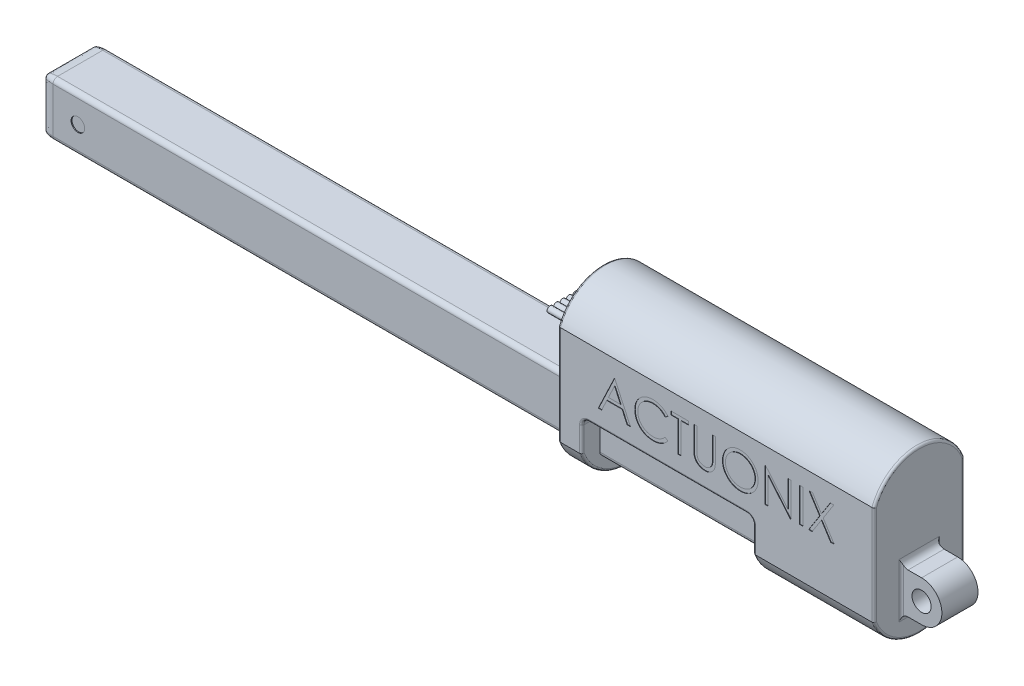
from build123d import *

# Parameters (mm, degrees)
SKETCH1_R               = 2.125
BOSS_EXTRUDE1_DEPTH     = 10
SKETCH2_W               = 9
SKETCH2_H               = 6
CUT_EXTRUDE1_DEPTH      = 58.723478759
SKETCH3_W               = 38
SKETCH3_H               = 4.5
CUT_EXTRUDE2_DEPTH      = 52.575187833
SKETCH4_W               = 38
SKETCH4_H               = 4
CUT_EXTRUDE3_DEPTH      = 9.5
CUT_EXTRUDE4_DEPTH      = 73.965745388
CUT_EXTRUDE4_DEPTH_BACK = 73.965745388
CUT_EXTRUDE5_DEPTH      = 73.965745388
BOSS_EXTRUDE2_DEPTH     = 4.31
SKETCH8_R               = 0.675
BOSS_EXTRUDE3_DEPTH     = 7.5
BOSS_EXTRUDE3_2_DEPTH   = 7.5
BOSS_EXTRUDE3_3_DEPTH   = 7.5
BOSS_EXTRUDE3_4_DEPTH   = 7.5
BOSS_EXTRUDE3_5_DEPTH   = 7.5
BOSS_EXTRUDE4_DEPTH     = 117.9
SKETCH10_R              = 4.5
CUT_EXTRUDE6_DEPTH      = 50
SKETCH12_W              = 0.673076923
SKETCH12_H              = 7.5
CUT_EXTRUDE7_DEPTH      = 0.1
SKETCH13_W              = 0.673076923
SKETCH13_H              = 7.5
CUT_EXTRUDE8_DEPTH      = 0.1
FILLET1_SIZE            = 2
FILLET1_SIZE_2          = 0.5
SKETCH14_R              = 1.5
CUT_EXTRUDE9_DEPTH      = 0.2
SKETCH15_R              = 1.5
CUT_EXTRUDE10_DEPTH     = 0.2
FILLET2_R               = 1.5
FILLET3_R               = 1.5
FILLET4_R               = 0.5
FILLET5_R               = 1
FILLET6_R               = 0.5


with BuildPart() as part:
    # Sketch1 → Boss-Extrude1 (new, symmetric)
    with BuildSketch(Plane.XY):
        with BuildLine():
            Line((39.5, -12), (35, -12))
            Line((35, -12), (35, -18))
            Line((35, -18), (-35, -18))
            Line((-35, -18), (-35, 18))
            Line((-35, 18), (35, 18))
            Line((35, 18), (35, -3))
            Line((35, -3), (39.5, -3))
            ThreePointArc((39.5, -3), (44, -7.5), (39.5, -12))
        make_face()
        with Locations((39.5, -7.5)):
            Circle(SKETCH1_R, mode=Mode.SUBTRACT)
    extrude(amount=BOSS_EXTRUDE1_DEPTH, both=True)

    # Sketch2 → Cut-Extrude1 (cut, through all)
    with BuildSketch(Plane(origin=(0, 18, 0), x_dir=(1, 0, 0), z_dir=(0, 1, 0))):
        with Locations((39.5, -7)):
            Rectangle(SKETCH2_W, SKETCH2_H)
        with Locations((39.5, 7)):
            Rectangle(SKETCH2_W, SKETCH2_H)
    extrude(amount=-CUT_EXTRUDE1_DEPTH, mode=Mode.SUBTRACT)

    # Sketch3 → Cut-Extrude2 (cut, through all)
    with BuildSketch(Plane.XY.offset(10)):
        with Locations((-10.75, -15.75)):
            Rectangle(SKETCH3_W, SKETCH3_H)
    extrude(amount=-CUT_EXTRUDE2_DEPTH, mode=Mode.SUBTRACT)

    # Sketch4 → Cut-Extrude3 (cut)
    with BuildSketch(Plane.XZ.offset(13.5)):
        with Locations((-10.75, -8)):
            Rectangle(SKETCH4_W, SKETCH4_H)
        with Locations((-10.75, 8)):
            Rectangle(SKETCH4_W, SKETCH4_H)
    extrude(amount=-CUT_EXTRUDE3_DEPTH, mode=Mode.SUBTRACT)

    # Sketch6 → Cut-Extrude4 (cut, two sides: drawn at the far end of the back side and taken through both)
    with BuildSketch(Plane(origin=(35, 0, 0), x_dir=(0, 0, -1), z_dir=(1, 0, 0)).offset(-CUT_EXTRUDE4_DEPTH_BACK)):
        with BuildLine():
            Line((-10, 18), (-10, 11))
            ThreePointArc((-10, 11), (-6.103277819, 16.076111146), (-2.8e-08, 18))
            Line((-2.8e-08, 18), (-10, 18))
        make_face()
        with BuildLine():
            Line((10, 18), (-2.8e-08, 18))
            ThreePointArc((-2.8e-08, 18), (6.103277797, 16.076111162), (10, 11))
            Line((10, 11), (10, 18))
        make_face()
    extrude(amount=CUT_EXTRUDE4_DEPTH + CUT_EXTRUDE4_DEPTH_BACK, mode=Mode.SUBTRACT)

    # Sketch7 → Cut-Extrude5 (cut, through all)
    with BuildSketch(Plane(origin=(35, 0, 0), x_dir=(0, 0, -1), z_dir=(1, 0, 0))):
        with BuildLine():
            ThreePointArc((-4.6e-08, -18), (-6.103277827, -16.076111141), (-10, -11))
            Line((-10, -11), (-10, -18))
            Line((-10, -18), (-4.6e-08, -18))
        make_face()
        with BuildLine():
            ThreePointArc((10, -11), (6.103277789, -16.076111167), (-4.6e-08, -18))
            Line((-4.6e-08, -18), (10, -18))
            Line((10, -18), (10, -11))
        make_face()
    extrude(amount=-CUT_EXTRUDE5_DEPTH, mode=Mode.SUBTRACT)

    # Sketch12 → Cut-Extrude7 (cut)
    # profile 1 of 8: a face of its own
    with BuildSketch(Plane.XY.offset(10)):
        Polygon((-22.451923077, 7.25), (-18.990384615, -0.25), (-19.722055288, -0.25), (-20.830829327, 2.153846154), (-24.230769231, 2.153846154), (-25.37109375, -0.25), (-26.105769231, -0.25), (-22.548076923, 7.25), align=None)
        Polygon((-22.507512019, 5.788161058), (-23.865685096, 2.923076923), (-21.185396635, 2.923076923), align=None, mode=Mode.SUBTRACT)
    # profile 2 of 8: a face of its own
    with BuildSketch(Plane.XY.offset(10)):
        with BuildLine():
            Line((-10.721153846, 5.873798077), (-11.310096154, 5.423076923))
            add(Edge.make_bspline(
                [(-11.310096154, 5.423076923), (-11.352108772, 5.473146858), (-11.435567586, 5.572611678), (-11.569837306, 5.71228213), (-11.709769398, 5.843136262), (-11.855310372, 5.965797433), (-12.009079914, 6.075976216), (-12.167353054, 6.179414294), (-12.332777436, 6.272130875), (-12.561531153, 6.38455156), (-12.860776543, 6.501864749), (-13.237479769, 6.600228816), (-13.630717837, 6.662845621), (-13.898998408, 6.669627424), (-14.035456731, 6.673076923)],
                knots=[0, 0, 0, 0, 0.757959112, 1.505699292, 2.245454638, 2.979532153, 3.711538275, 4.438200793, 5.171680507, 5.909471876, 7.393775596, 8.890124382, 10.418191784, 12, 12, 12, 12], degree=3))
            add(Edge.make_bspline(
                [(-14.035456731, 6.673076923), (-14.110635229, 6.672211289), (-14.260294499, 6.670488055), (-14.482398371, 6.647754215), (-14.700354909, 6.615801622), (-14.914022337, 6.568390216), (-15.123128676, 6.508448889), (-15.329040967, 6.436823002), (-15.528777966, 6.348205488), (-15.725102762, 6.250259217), (-15.913201072, 6.139628978), (-16.091176174, 6.01895751), (-16.258378962, 5.88959516), (-16.414941703, 5.751057075), (-16.561024449, 5.60396716), (-16.695568687, 5.446757856), (-16.818108851, 5.27993177), (-16.931073905, 5.105688754), (-17.032244048, 4.924536343), (-17.116950932, 4.73580405), (-17.191961909, 4.542723829), (-17.251317428, 4.343114198), (-17.298298536, 4.1383797), (-17.330714957, 3.927970869), (-17.353190253, 3.71232727), (-17.354904917, 3.566164457), (-17.355769231, 3.492487981)],
                knots=[0, 0, 0, 0, 1.054917814, 2.100044995, 3.131103042, 4.146048494, 5.169673617, 6.183595914, 7.203665975, 8.234915748, 9.262203917, 10.264457458, 11.251630812, 12.227803204, 13.197192746, 14.159520551, 15.12972552, 16.100847026, 17.073214652, 18.039054194, 19.002613845, 19.979014051, 20.95965708, 21.949030935, 22.966165397, 24, 24, 24, 24], degree=3))
            add(Edge.make_bspline(
                [(-17.355769231, 3.492487981), (-17.353065333, 3.381635152), (-17.347756588, 3.163990328), (-17.300510158, 2.845196162), (-17.228713534, 2.539794718), (-17.121108726, 2.249695056), (-16.988425046, 1.971320003), (-16.820766593, 1.709379603), (-16.626588299, 1.459915536), (-16.403143114, 1.228823505), (-16.157987794, 1.017722666), (-15.894956555, 0.831828562), (-15.61470451, 0.6768681), (-15.320326016, 0.547919643), (-15.009555772, 0.448798084), (-14.682952624, 0.379017819), (-14.34122692, 0.333498861), (-14.107721063, 0.329140958), (-13.988882212, 0.326923077)],
                knots=[0, 0, 0, 0, 1.029171465, 2.020641659, 2.987623507, 3.938342917, 4.889210282, 5.84687017, 6.821220943, 7.821438502, 8.827599549, 9.822697543, 10.807740252, 11.797342354, 12.80366471, 13.83203677, 14.896651826, 16, 16, 16, 16], degree=3))
            add(Edge.make_bspline(
                [(-13.988882212, 0.326923077), (-13.857947878, 0.330541891), (-13.600237787, 0.337664582), (-13.222306302, 0.39800583), (-12.860515376, 0.495844225), (-12.514845548, 0.632768345), (-12.186271306, 0.81076539), (-11.874278462, 1.026546556), (-11.578603668, 1.282164412), (-11.400808064, 1.477342544), (-11.310096154, 1.576923077)],
                knots=[0, 0, 0, 0, 1.028121516, 2.023589091, 2.998037872, 3.967518031, 4.937445131, 5.927275754, 6.942489185, 8, 8, 8, 8], degree=3))
            Line((-11.310096154, 1.576923077), (-10.721153846, 1.130709135))
            add(Edge.make_bspline(
                [(-10.721153846, 1.130709135), (-10.768549796, 1.069555309), (-10.863114671, 0.947540581), (-11.016238994, 0.775529775), (-11.177547488, 0.613735413), (-11.348238295, 0.463461939), (-11.526347849, 0.32170237), (-11.715074232, 0.19248416), (-11.911936445, 0.074003694), (-12.116267471, -0.034482573), (-12.327850213, -0.130733817), (-12.546431145, -0.213134748), (-12.771068092, -0.284116654), (-13.001771324, -0.342513661), (-13.239019375, -0.388094555), (-13.481956105, -0.418565287), (-13.731105838, -0.439440818), (-13.899194597, -0.441343495), (-13.984375, -0.442307692)],
                knots=[0, 0, 0, 0, 0.986787822, 1.968848986, 2.935600012, 3.899624008, 4.868462664, 5.837806735, 6.815139263, 7.798259679, 8.787526145, 9.778297419, 10.776456485, 11.791383307, 12.812564526, 13.85620153, 14.913611965, 16, 16, 16, 16], degree=3))
            add(Edge.make_bspline(
                [(-13.984375, -0.442307692), (-14.065040001, -0.44174628), (-14.224545051, -0.440636156), (-14.460042376, -0.42265294), (-14.689305763, -0.398117789), (-14.911679962, -0.361174651), (-15.12837848, -0.317579637), (-15.337436875, -0.25914123), (-15.540912326, -0.19367873), (-15.737987341, -0.116739473), (-15.928829555, -0.029919082), (-16.112823437, 0.068205687), (-16.289884363, 0.176809683), (-16.461753122, 0.293498991), (-16.625890802, 0.422021781), (-16.783719785, 0.560593141), (-16.936125091, 0.708746021), (-17.030416559, 0.815577849), (-17.077824519, 0.869290865)],
                knots=[0, 0, 0, 0, 1.114604814, 2.203992996, 3.262667896, 4.300477797, 5.318619304, 6.316056647, 7.298880507, 8.271930387, 9.238335007, 10.195173496, 11.151986948, 12.108099108, 13.064862484, 14.031167946, 15.010108607, 16, 16, 16, 16], degree=3))
            add(Edge.make_bspline(
                [(-17.077824519, 0.869290865), (-17.153758041, 0.962593413), (-17.304708349, 1.148072078), (-17.497834813, 1.448684895), (-17.663151003, 1.762545343), (-17.79681369, 2.091302333), (-17.901305261, 2.434218163), (-17.973693537, 2.791465694), (-18.020732689, 3.162711284), (-18.026111879, 3.415218688), (-18.028846154, 3.543569712)],
                knots=[0, 0, 0, 0, 0.994628077, 1.977248131, 2.950237994, 3.925870899, 4.908910175, 5.911660606, 6.938484602, 8, 8, 8, 8], degree=3))
            add(Edge.make_bspline(
                [(-18.028846154, 3.543569712), (-18.025513596, 3.678474255), (-18.018956997, 3.943890522), (-17.963251721, 4.333406136), (-17.873640015, 4.706587705), (-17.746360968, 5.062738586), (-17.584992358, 5.403732044), (-17.385649614, 5.726963197), (-17.150648595, 6.034499196), (-16.881832379, 6.321673663), (-16.587045232, 6.58425799), (-16.271362059, 6.815271284), (-15.935400744, 7.007523104), (-15.58286249, 7.168229167), (-15.211107458, 7.291753016), (-14.82092881, 7.37822413), (-14.413059707, 7.432046522), (-14.134783081, 7.438850539), (-13.993389423, 7.442307692)],
                knots=[0, 0, 0, 0, 1.032925535, 2.032216505, 3.007276963, 3.968222605, 4.92396291, 5.891752235, 6.871517503, 7.883894988, 8.900124299, 9.891468569, 10.874487609, 11.85992873, 12.854644235, 13.869047385, 14.917252991, 16, 16, 16, 16], degree=3))
            add(Edge.make_bspline(
                [(-13.993389423, 7.442307692), (-13.907215555, 7.441274539), (-13.73664306, 7.439229516), (-13.484315948, 7.419287783), (-13.238653819, 7.386044341), (-12.999487429, 7.34079562), (-12.765653251, 7.284637074), (-12.538938449, 7.211479292), (-12.318012692, 7.127829582), (-12.104269317, 7.031490012), (-11.898733853, 6.923346995), (-11.701470313, 6.80459923), (-11.514045616, 6.675393933), (-11.33514094, 6.536829985), (-11.16774906, 6.38597593), (-11.00711732, 6.226981081), (-10.858700724, 6.055265744), (-10.767086735, 5.934398028), (-10.721153846, 5.873798077)],
                knots=[0, 0, 0, 0, 1.096760587, 2.17092713, 3.219439832, 4.250915756, 5.268269357, 6.278326846, 7.281116186, 8.274029601, 9.260640565, 10.235837813, 11.203064059, 12.156899882, 13.114053108, 14.069676657, 15.032185724, 16, 16, 16, 16], degree=3))
        make_face()
    # profile 3 of 8: a face of its own
    with BuildSketch(Plane.XY.offset(10)):
        Polygon((-10.048076923, 6.480769231), (-10.048076923, 7.25), (-6.105769231, 7.25), (-6.105769231, 6.480769231), (-7.740384615, 6.480769231), (-7.740384615, -0.25), (-8.413461538, -0.25), (-8.413461538, 6.480769231), align=None)
    # profile 4 of 8: a face of its own
    with BuildSketch(Plane.XY.offset(10)):
        with BuildLine():
            Line((-4.951923077, 7.25), (-4.278846154, 7.25))
            Line((-4.278846154, 7.25), (-4.278846154, 2.756310096))
            add(Edge.make_bspline(
                [(-4.278846154, 2.756310096), (-4.27894632, 2.69270852), (-4.279136401, 2.572013568), (-4.277866729, 2.400224352), (-4.274310939, 2.247497654), (-4.272069169, 2.113244766), (-4.267082025, 1.998081736), (-4.263014782, 1.901384642), (-4.257785018, 1.823611351), (-4.251499766, 1.778223652), (-4.248798077, 1.758713942)],
                knots=[0, 0, 0, 0, 1.528628734, 2.90083645, 4.128790002, 5.200304208, 6.127813768, 6.898992206, 7.526736466, 8, 8, 8, 8], degree=3))
            add(Edge.make_bspline(
                [(-4.248798077, 1.758713942), (-4.237703522, 1.688328021), (-4.216139552, 1.551522173), (-4.161183028, 1.356718712), (-4.08443124, 1.181151301), (-3.993481863, 1.019341391), (-3.873626267, 0.875792763), (-3.730047263, 0.743553507), (-3.556094902, 0.62789964), (-3.362679318, 0.5221479), (-3.154210952, 0.437151295), (-2.94118681, 0.3728798), (-2.726808997, 0.333710729), (-2.583288644, 0.329175288), (-2.512019231, 0.326923077)],
                knots=[0, 0, 0, 0, 1.035780045, 2.013197591, 2.933192213, 3.817615948, 4.702609284, 5.640816605, 6.646850145, 7.73207398, 8.84249596, 9.914020372, 10.964143139, 12, 12, 12, 12], degree=3))
            add(Edge.make_bspline(
                [(-2.512019231, 0.326923077), (-2.450832644, 0.329224185), (-2.328812869, 0.33381311), (-2.147513374, 0.362230462), (-1.970941713, 0.41344596), (-1.79822597, 0.479531156), (-1.636331004, 0.566847423), (-1.485166485, 0.667713507), (-1.350243769, 0.786022528), (-1.227119488, 0.916951837), (-1.119901768, 1.06467998), (-1.026963608, 1.225990276), (-0.950836615, 1.403310305), (-0.913243348, 1.527926924), (-0.893930288, 1.591947115)],
                knots=[0, 0, 0, 0, 0.994687771, 1.983630487, 2.973142513, 3.978332533, 4.983357753, 5.956394766, 6.925816176, 7.893390482, 8.871859704, 9.88551698, 10.913711441, 12, 12, 12, 12], degree=3))
            add(Edge.make_bspline(
                [(-0.893930288, 1.591947115), (-0.887501449, 1.618408346), (-0.873175402, 1.677374632), (-0.859788877, 1.777063112), (-0.845846323, 1.894683177), (-0.836172244, 2.031079919), (-0.826741058, 2.185796289), (-0.821098759, 2.359638269), (-0.818490831, 2.551974614), (-0.817713659, 2.686197103), (-0.817307692, 2.756310096)],
                knots=[0, 0, 0, 0, 0.558680831, 1.244966039, 2.062412453, 2.990489873, 4.051219941, 5.244515665, 6.560634259, 8, 8, 8, 8], degree=3))
            Line((-0.817307692, 2.756310096), (-0.817307692, 7.25))
            Line((-0.817307692, 7.25), (-0.144230769, 7.25))
            Line((-0.144230769, 7.25), (-0.144230769, 2.720252404))
            add(Edge.make_bspline(
                [(-0.144230769, 2.720252404), (-0.144775313, 2.63861302), (-0.145838023, 2.4792888), (-0.155053544, 2.245821602), (-0.169747115, 2.024350928), (-0.190507304, 1.814847007), (-0.218015168, 1.618059523), (-0.248604926, 1.432263591), (-0.287561068, 1.258792892), (-0.333061214, 1.096294854), (-0.385075959, 0.941611611), (-0.452449849, 0.794807437), (-0.528359491, 0.651419438), (-0.61839089, 0.513616347), (-0.719558139, 0.380788019), (-0.834097455, 0.253740001), (-0.958220657, 0.130442045), (-1.093991142, 0.014056903), (-1.239170839, -0.092675976), (-1.393327891, -0.186528342), (-1.555278112, -0.265864666), (-1.724600525, -0.331170218), (-1.901367388, -0.38027293), (-2.085583159, -0.41686255), (-2.277667145, -0.437653187), (-2.408305694, -0.440743038), (-2.474459135, -0.442307692)],
                knots=[0, 0, 0, 0, 1.316592851, 2.569410997, 3.76748051, 4.895814652, 5.963796859, 6.97159953, 7.931736103, 8.829262218, 9.692595152, 10.560224239, 11.431080259, 12.30701507, 13.211635791, 14.121146779, 15.063487852, 16.031507147, 17.00238618, 17.966455255, 18.938106653, 19.907068911, 20.888905087, 21.893141452, 22.933117798, 24, 24, 24, 24], degree=3))
            add(Edge.make_bspline(
                [(-2.474459135, -0.442307692), (-2.546607212, -0.440626052), (-2.688161481, -0.437326681), (-2.896743053, -0.418420788), (-3.096702045, -0.382809943), (-3.290150353, -0.337467206), (-3.474454276, -0.274930627), (-3.652083085, -0.201863216), (-3.819994545, -0.11212623), (-3.980912677, -0.012283245), (-4.130537155, 0.100055266), (-4.267888733, 0.222498495), (-4.39319417, 0.353085018), (-4.504341376, 0.493228659), (-4.603171843, 0.64183946), (-4.688308015, 0.799337831), (-4.761407824, 0.965662794), (-4.799136182, 1.081276795), (-4.818209135, 1.139723558)],
                knots=[0, 0, 0, 0, 1.13879206, 2.234305948, 3.301075583, 4.341971843, 5.366689343, 6.369221514, 7.369726634, 8.367512178, 9.355451585, 10.318319045, 11.268648973, 12.207971039, 13.137398894, 14.081662264, 15.030215811, 16, 16, 16, 16], degree=3))
            add(Edge.make_bspline(
                [(-4.818209135, 1.139723558), (-4.829303045, 1.179650503), (-4.853365984, 1.266252936), (-4.879134479, 1.409581126), (-4.900796796, 1.574613093), (-4.92116585, 1.761360132), (-4.933185045, 1.969966989), (-4.943722414, 2.200343237), (-4.951997311, 2.452767441), (-4.951948513, 2.628598546), (-4.951923077, 2.720252404)],
                knots=[0, 0, 0, 0, 0.625038921, 1.35572334, 2.194682327, 3.136881307, 4.189498639, 5.346923369, 6.617055217, 8, 8, 8, 8], degree=3))
            Line((-4.951923077, 2.720252404), (-4.951923077, 7.25))
        make_face()
    # profile 5 of 8: a face of its own
    with BuildSketch(Plane.XY.offset(10)):
        with BuildLine():
            add(Edge.make_bspline(
                [(5.288461538, 7.442307692), (5.427336051, 7.438790237), (5.700097052, 7.431881663), (6.100971833, 7.37899787), (6.483675608, 7.287507748), (6.851325906, 7.1656585), (7.199525141, 7.003113389), (7.530894196, 6.806645214), (7.84464464, 6.574195659), (8.136547601, 6.307561602), (8.403669637, 6.0174542), (8.639010822, 5.707858679), (8.836244309, 5.38064696), (8.998213852, 5.036802323), (9.125282302, 4.677102391), (9.212965967, 4.299629528), (9.268976289, 3.906829478), (9.275524383, 3.638914768), (9.278846154, 3.503004808)],
                knots=[0, 0, 0, 0, 1.065120563, 2.091984664, 3.0946048, 4.079830382, 5.057816894, 6.036188127, 7.030412546, 8.04752943, 9.064399622, 10.05169764, 11.02544977, 11.989514704, 12.962713494, 13.945757189, 14.957906945, 16, 16, 16, 16], degree=3))
            add(Edge.make_bspline(
                [(9.278846154, 3.503004808), (9.27552487, 3.368095994), (9.268978234, 3.102175093), (9.212902283, 2.711867713), (9.124957283, 2.336673363), (8.999393855, 1.977218393), (8.838196401, 1.633123613), (8.639649606, 1.305294427), (8.405775583, 0.993623359), (8.139618045, 0.70152479), (7.849472955, 0.433673067), (7.53826524, 0.200275477), (7.21299384, -0.000561933), (6.869473037, -0.160812663), (6.512258673, -0.28889535), (6.138153695, -0.376222414), (5.748911079, -0.432551793), (5.483473214, -0.439020041), (5.348557692, -0.442307692)],
                knots=[0, 0, 0, 0, 1.043624062, 2.057103931, 3.04512605, 4.022047818, 4.998200453, 5.980619268, 6.982898556, 8.009068085, 9.034988726, 10.034168286, 11.015286542, 11.987931943, 12.962482838, 13.94673481, 14.956375938, 16, 16, 16, 16], degree=3))
            add(Edge.make_bspline(
                [(5.348557692, -0.442307692), (5.212648437, -0.438987578), (4.944735117, -0.432442748), (4.55144147, -0.376339737), (4.173703448, -0.288608372), (3.812601267, -0.163231009), (3.46793356, -0.001194086), (3.13902624, 0.196386726), (2.827199496, 0.4308306), (2.535038611, 0.696901832), (2.2677189, 0.986555157), (2.034663095, 1.296914275), (1.837037853, 1.621890254), (1.675544997, 1.962384948), (1.547692584, 2.316752326), (1.460467974, 2.687356206), (1.404033791, 3.072083718), (1.397530549, 3.334032786), (1.394230769, 3.466947115)],
                knots=[0, 0, 0, 0, 1.053102029, 2.075944431, 3.073151272, 4.055350789, 5.033113405, 6.020478099, 7.024410459, 8.052272461, 9.079885166, 10.07527673, 11.055994387, 12.023226415, 12.992069828, 13.970394897, 14.97016774, 16, 16, 16, 16], degree=3))
            add(Edge.make_bspline(
                [(1.394230769, 3.466947115), (1.395376417, 3.556159978), (1.397653259, 3.733460242), (1.425064028, 3.996745814), (1.464839102, 4.255797224), (1.521843201, 4.509877827), (1.596396773, 4.758365651), (1.684365403, 5.002974428), (1.791807929, 5.241225265), (1.91326646, 5.474246819), (2.048827478, 5.698406617), (2.198561226, 5.910291438), (2.357208444, 6.111679288), (2.531130002, 6.297351439), (2.714593813, 6.472709274), (2.910576052, 6.635057954), (3.117880862, 6.78586142), (3.337400247, 6.921762151), (3.563725122, 7.044674582), (3.797032503, 7.150149977), (4.034153727, 7.240677252), (4.276199401, 7.314050449), (4.52252677, 7.37197624), (4.773673451, 7.411420569), (5.029439365, 7.438901251), (5.201749334, 7.441167326), (5.288461538, 7.442307692)],
                knots=[0, 0, 0, 0, 1.037015668, 2.060948919, 3.074880161, 4.083647147, 5.086022904, 6.090072063, 7.104153813, 8.122640571, 9.144368836, 10.147691507, 11.138137339, 12.123020368, 13.103399296, 14.087645067, 15.080126199, 16.082011238, 17.087798457, 18.072939717, 19.057185487, 20.037253025, 21.01195951, 21.997135196, 22.992090687, 24, 24, 24, 24], degree=3))
        make_face()
        with BuildLine():
            add(Edge.make_bspline(
                [(5.321514423, 6.673076923), (5.250340208, 6.672209301), (5.108672209, 6.670482352), (4.898062489, 6.64773439), (4.69022263, 6.615313199), (4.485109712, 6.569067083), (4.283581949, 6.506058399), (4.08376086, 6.433542167), (3.887468602, 6.345211258), (3.695353192, 6.245412606), (3.509106603, 6.134950633), (3.3333651, 6.012868275), (3.16767372, 5.882028516), (3.012438148, 5.742126007), (2.868114208, 5.592448289), (2.731861276, 5.435264498), (2.609140744, 5.266081874), (2.496671651, 5.089488145), (2.396026279, 4.905713328), (2.30652909, 4.716692195), (2.2333205, 4.520882866), (2.173615408, 4.320409671), (2.124115813, 4.115590115), (2.092757404, 3.904870438), (2.069759491, 3.689309484), (2.068131251, 3.543634083), (2.067307692, 3.469951923)],
                knots=[0, 0, 0, 0, 1.008559885, 2.007477868, 2.99961109, 3.989939068, 4.984837346, 5.991145699, 7.001802488, 8.033829008, 9.059044045, 10.069351652, 11.065060232, 12.050310815, 13.029377138, 14.011219647, 14.996725999, 15.989392538, 16.977580475, 17.965360261, 18.951710183, 19.937753436, 20.929683414, 21.935841486, 22.955955122, 24, 24, 24, 24], degree=3))
            add(Edge.make_bspline(
                [(2.067307692, 3.469951923), (2.070039539, 3.361604307), (2.075413928, 3.148451028), (2.122465864, 2.83609072), (2.194941523, 2.535901535), (2.301778737, 2.249526015), (2.435387197, 1.974502551), (2.600444819, 1.713270899), (2.796000002, 1.465760454), (3.018136131, 1.233699163), (3.260970502, 1.021886725), (3.518826352, 0.835965135), (3.788941225, 0.678657457), (4.072019517, 0.550503731), (4.366549957, 0.448954292), (4.674430424, 0.379357226), (4.99360998, 0.333552678), (5.21117567, 0.329153916), (5.321514423, 0.326923077)],
                knots=[0, 0, 0, 0, 1.032063989, 2.030389145, 3.003944642, 3.970395727, 4.937377036, 5.913328081, 6.909231446, 7.93887556, 8.970685674, 9.976071282, 10.964166581, 11.944589148, 12.933237628, 13.927779006, 14.949070134, 16, 16, 16, 16], degree=3))
            add(Edge.make_bspline(
                [(5.321514423, 0.326923077), (5.395677641, 0.327942015), (5.542765576, 0.329962875), (5.761541695, 0.350317182), (5.976376435, 0.382956902), (6.186968463, 0.429951164), (6.393078773, 0.488766607), (6.595567637, 0.55864031), (6.792278259, 0.645814318), (6.985692197, 0.742131357), (7.170827001, 0.851931694), (7.347560284, 0.969870586), (7.511437384, 1.100517631), (7.666556823, 1.238341515), (7.811473299, 1.386121189), (7.945206837, 1.543664521), (8.06730712, 1.71196593), (8.179733506, 1.888291799), (8.280026211, 2.072569483), (8.367409995, 2.262275936), (8.441544529, 2.456944028), (8.501391325, 2.656854538), (8.548288743, 2.861627785), (8.580602857, 3.071537953), (8.603206654, 3.286165115), (8.604910391, 3.431330521), (8.605769231, 3.504507212)],
                knots=[0, 0, 0, 0, 1.047197238, 2.076906641, 3.100256066, 4.114471768, 5.12198147, 6.126382909, 7.136867548, 8.15857795, 9.17633901, 10.174870724, 11.156907918, 12.133735059, 13.104061851, 14.077631395, 15.04955518, 16.038496417, 17.029181396, 18.010275684, 18.986308667, 19.968651475, 20.955262928, 21.950658345, 22.966943676, 24, 24, 24, 24], degree=3))
            add(Edge.make_bspline(
                [(8.605769231, 3.504507212), (8.604909703, 3.577183292), (8.603204671, 3.721349685), (8.580613654, 3.93448001), (8.548254603, 4.142879749), (8.501620229, 4.345730756), (8.441512757, 4.543084738), (8.367397049, 4.73475634), (8.279999978, 4.921459615), (8.17969664, 5.102733109), (8.066948447, 5.276678976), (7.943746497, 5.44296986), (7.807963608, 5.598482877), (7.663479269, 5.747057222), (7.506684515, 5.885524128), (7.338289599, 6.013929529), (7.160338861, 6.13537226), (6.971923357, 6.244927035), (6.777472027, 6.346100391), (6.577942117, 6.432781112), (6.375594047, 6.506435654), (6.170942377, 6.569257722), (5.962264567, 6.615132072), (5.750970648, 6.647763607), (5.537352951, 6.670474434), (5.393688909, 6.672206674), (5.321514423, 6.673076923)],
                knots=[0, 0, 0, 0, 1.02996197, 2.043119294, 3.035359645, 4.018872909, 4.991431989, 5.957985074, 6.929999688, 7.912076566, 8.892894881, 9.867085534, 10.843653904, 11.817741046, 12.803660682, 13.806313499, 14.818574707, 15.856120519, 16.894564902, 17.924820532, 18.937903209, 19.946497019, 20.957711757, 21.963978472, 22.977135795, 24, 24, 24, 24], degree=3))
        make_face(mode=Mode.SUBTRACT)
    # profile 6 of 8: a face of its own
    with BuildSketch(Plane.XY.offset(10)):
        Polygon((10.817307692, -0.25), (10.817307692, 7.25), (10.958533654, 7.25), (15.913461538, 1.347055288), (15.913461538, 7.25), (16.586538462, 7.25), (16.586538462, -0.25), (16.433293269, -0.25), (11.490384615, 5.639423077), (11.490384615, -0.25), align=None)
    # profile 7 of 8: a face of its own
    with BuildSketch(Plane.XY.offset(10)):
        with Locations((18.846153847, 3.5)):
            Rectangle(SKETCH12_W, SKETCH12_H)
    # profile 8 of 8: a face of its own
    with BuildSketch(Plane.XY.offset(10)):
        Polygon((20.576923077, 7.25), (21.353665865, 7.25), (23.317307692, 4.182091346), (25.280949519, 7.25), (26.057692308, 7.25), (23.706430288, 3.575120192), (26.153846154, -0.25), (25.377103365, -0.25), (23.317307692, 2.968149038), (21.257512019, -0.25), (20.480769231, -0.25), (22.9296875, 3.575120192), align=None)
    extrude(amount=-CUT_EXTRUDE7_DEPTH, mode=Mode.SUBTRACT)

    # Sketch13 → Cut-Extrude8 (cut)
    # profile 1 of 8: a face of its own
    with BuildSketch(Plane(origin=(0, 0, -10), x_dir=(-1, 0, 0), z_dir=(0, 0, -1))):
        Polygon((-20.576923077, -0.25), (-21.353665865, -0.25), (-23.317307692, 2.817908654), (-25.280949519, -0.25), (-26.057692308, -0.25), (-23.706430288, 3.424879808), (-26.153846154, 7.25), (-25.377103365, 7.25), (-23.317307692, 4.031850962), (-21.257512019, 7.25), (-20.480769231, 7.25), (-22.9296875, 3.424879808), align=None)
    # profile 2 of 8: a face of its own
    with BuildSketch(Plane(origin=(0, 0, -10), x_dir=(-1, 0, 0), z_dir=(0, 0, -1))):
        with Locations((-19.134615385, 3.5)):
            Rectangle(SKETCH13_W, SKETCH13_H)
    # profile 3 of 8: a face of its own
    with BuildSketch(Plane(origin=(0, 0, -10), x_dir=(-1, 0, 0), z_dir=(0, 0, -1))):
        Polygon((-11.105769231, 7.25), (-11.105769231, -0.25), (-11.246995192, -0.25), (-16.201923077, 5.652944712), (-16.201923077, -0.25), (-16.875, -0.25), (-16.875, 7.25), (-16.721754808, 7.25), (-11.778846154, 1.360576923), (-11.778846154, 7.25), align=None)
    # profile 4 of 8: a face of its own
    with BuildSketch(Plane(origin=(0, 0, -10), x_dir=(-1, 0, 0), z_dir=(0, 0, -1))):
        with BuildLine():
            add(Edge.make_bspline(
                [(-5.576923077, -0.442307692), (-5.715812703, -0.438849419), (-5.988603389, -0.432057085), (-6.389149903, -0.378347285), (-6.772689323, -0.289944149), (-7.139450726, -0.165108517), (-7.488007691, -0.00324434), (-7.819462205, 0.193262403), (-8.132674969, 0.426342987), (-8.42683588, 0.690464481), (-8.694199703, 0.980789188), (-8.926849555, 1.292473212), (-9.124856277, 1.619243228), (-9.286634848, 1.963227274), (-9.413754855, 2.322889568), (-9.501424461, 2.700372694), (-9.557438624, 3.09316994), (-9.56398619, 3.361085036), (-9.567307692, 3.496995192)],
                knots=[0, 0, 0, 0, 1.065027606, 2.091802087, 3.093458616, 4.079833113, 5.057734272, 6.036020118, 7.030157768, 8.047461502, 9.064242947, 10.052216774, 11.02588392, 11.989864716, 12.962978571, 13.945936472, 14.957997893, 16, 16, 16, 16], degree=3))
            add(Edge.make_bspline(
                [(-9.567307692, 3.496995192), (-9.563985077, 3.631903423), (-9.557435818, 3.897823175), (-9.501378948, 4.288138913), (-9.413363892, 4.663302576), (-9.28820744, 5.022441582), (-9.126309704, 5.365732267), (-8.927991417, 5.692730912), (-8.695864259, 6.005323772), (-8.429596638, 6.297061759), (-8.13883022, 6.564450245), (-7.829071863, 6.800825686), (-7.50069535, 6.997739983), (-7.158825835, 7.161937002), (-6.800060957, 7.286294311), (-6.426930993, 7.376915737), (-6.037320266, 7.432365389), (-5.77191711, 7.438957225), (-5.637019231, 7.442307692)],
                knots=[0, 0, 0, 0, 1.043683505, 2.0572211, 3.045299494, 4.022276905, 4.994977706, 5.977452478, 6.97747046, 8.003698437, 9.029677512, 10.031249186, 11.013723958, 11.988083691, 12.9614021, 13.946617861, 14.956316495, 16, 16, 16, 16], degree=3))
            add(Edge.make_bspline(
                [(-5.637019231, 7.442307692), (-5.50110971, 7.438988023), (-5.233195866, 7.432444072), (-4.83990603, 7.376334672), (-4.462154033, 7.288626736), (-4.101102971, 7.163163667), (-3.756634359, 7.001627803), (-3.428781514, 6.803124215), (-3.117150469, 6.569214999), (-2.824912431, 6.303156479), (-2.55784637, 6.012947623), (-2.322946347, 5.703595984), (-2.125587174, 5.378043673), (-1.963983118, 5.037632678), (-1.836160463, 4.683242902), (-1.748927775, 4.312645102), (-1.692495783, 3.92791594), (-1.68599224, 3.665967099), (-1.682692308, 3.533052885)],
                knots=[0, 0, 0, 0, 1.053167129, 2.076072758, 3.073341244, 4.055601477, 5.033424535, 6.017524495, 7.021518915, 8.049444456, 9.077120685, 10.074910483, 11.055688766, 12.022980584, 12.991883888, 13.970269434, 14.970104079, 16, 16, 16, 16], degree=3))
            add(Edge.make_bspline(
                [(-1.682692308, 3.533052885), (-1.683836905, 3.443839614), (-1.686111659, 3.266538539), (-1.713537885, 3.003258967), (-1.753255029, 2.744185073), (-1.810473665, 2.490187739), (-1.884280852, 2.241225487), (-1.975235688, 1.997807459), (-2.079469966, 1.757928606), (-2.203575272, 1.526154248), (-2.338977875, 1.302120598), (-2.486620809, 1.088629011), (-2.647533509, 0.889493024), (-2.819417376, 0.70151284), (-3.004651667, 0.527896853), (-3.200448612, 0.364859835), (-3.407832709, 0.214089485), (-3.627131941, 0.078752396), (-3.852755192, -0.045556364), (-4.086339369, -0.149343949), (-4.322956081, -0.241078256), (-4.56468954, -0.313979827), (-4.810980577, -0.371995332), (-5.062137083, -0.411415401), (-5.31790037, -0.438902568), (-5.490210694, -0.441167767), (-5.576923077, -0.442307692)],
                knots=[0, 0, 0, 0, 1.037115869, 2.061148057, 3.07517727, 4.084041727, 5.086514338, 6.092668487, 7.104487461, 8.125783165, 9.147610153, 10.147694368, 11.141876323, 12.122903372, 13.107606018, 14.091946891, 15.084523921, 16.086505767, 17.087268121, 18.077809654, 19.05670789, 20.036870126, 21.011670792, 21.99694167, 22.991993299, 24, 24, 24, 24], degree=3))
        make_face()
        with BuildLine():
            add(Edge.make_bspline(
                [(-5.609975962, 0.326923077), (-5.538800673, 0.327787258), (-5.397130538, 0.329507357), (-5.186536687, 0.3523062), (-4.978637074, 0.38453581), (-4.77388845, 0.431464315), (-4.57210771, 0.491594565), (-4.373070881, 0.565846817), (-4.176600224, 0.652531291), (-3.984492361, 0.753152485), (-3.799815331, 0.865938397), (-3.621459481, 0.984852196), (-3.456236437, 1.116633755), (-3.300954862, 1.256396136), (-3.155991486, 1.406063673), (-3.021326945, 1.564533826), (-2.89709391, 1.732524029), (-2.784781508, 1.909334344), (-2.684832549, 2.093979907), (-2.595343972, 2.282930469), (-2.521161378, 2.47840676), (-2.462397705, 2.679188904), (-2.412520812, 2.884392112), (-2.381234334, 3.0951344), (-2.358217054, 3.310689266), (-2.356591454, 3.456365498), (-2.355769231, 3.530048077)],
                knots=[0, 0, 0, 0, 1.008431664, 2.007222653, 2.999229743, 3.989431819, 4.982149843, 5.98167215, 6.998687425, 8.024288174, 9.053028776, 10.065052016, 11.06063401, 12.045759335, 13.024701188, 14.011819507, 14.991481775, 15.984022113, 16.97831254, 17.965966747, 18.945551853, 19.938269878, 20.93007375, 21.936103907, 22.956087853, 24, 24, 24, 24], degree=3))
            add(Edge.make_bspline(
                [(-2.355769231, 3.530048077), (-2.358507328, 3.63839323), (-2.363894013, 3.851541663), (-2.410856771, 4.163937117), (-2.483771092, 4.464454669), (-2.589483085, 4.751303118), (-2.724339592, 5.025761597), (-2.888837151, 5.286762015), (-3.084482216, 5.534227379), (-3.306587115, 5.766315557), (-3.549452968, 5.978067299), (-3.807217156, 6.164198193), (-4.077840344, 6.320851145), (-4.359762732, 6.451809492), (-4.655391322, 6.550468063), (-4.962830659, 6.620811577), (-5.282087539, 6.666403209), (-5.499642599, 6.670831241), (-5.609975962, 6.673076923)],
                knots=[0, 0, 0, 0, 1.032022337, 2.030307203, 3.003823408, 3.974715386, 4.937372378, 5.913284036, 6.909147208, 7.938749767, 8.970518239, 9.975863271, 10.963918693, 11.946286286, 12.933361397, 13.927862637, 14.949112547, 16, 16, 16, 16], degree=3))
            add(Edge.make_bspline(
                [(-5.609975962, 6.673076923), (-5.684139473, 6.67205881), (-5.831227991, 6.670039587), (-6.049999803, 6.649673188), (-6.264850709, 6.617078844), (-6.475383046, 6.569917044), (-6.68187522, 6.511675708), (-6.883694652, 6.439422098), (-7.080809984, 6.352849135), (-7.274056056, 6.256211628), (-7.45924717, 6.147222643), (-7.634280274, 6.027470463), (-7.800306417, 5.90016154), (-7.955304563, 5.76141131), (-8.099662743, 5.613006292), (-8.231920523, 5.453865674), (-8.356095634, 5.287133926), (-8.467620294, 5.110368553), (-8.568940358, 4.927184028), (-8.655800082, 4.737683407), (-8.730025305, 4.543066919), (-8.789847672, 4.343142508), (-8.836751687, 4.138373015), (-8.869064011, 3.928461828), (-8.891668292, 3.713834941), (-8.893371963, 3.568669498), (-8.894230769, 3.495492788)],
                knots=[0, 0, 0, 0, 1.047362266, 2.077233941, 3.100744636, 4.115120168, 5.122788643, 6.129711893, 7.140355774, 8.162227187, 9.180148637, 10.17298275, 11.156396779, 12.133377858, 13.108923632, 14.078087502, 15.054351192, 16.043448276, 17.028082865, 18.009331763, 18.985518559, 19.968016174, 20.954783108, 21.950335389, 22.966780876, 24, 24, 24, 24], degree=3))
            add(Edge.make_bspline(
                [(-8.894230769, 3.495492788), (-8.893371241, 3.422816708), (-8.89166621, 3.278650315), (-8.869075193, 3.06551999), (-8.836716142, 2.857120251), (-8.790081767, 2.654269245), (-8.729974297, 2.456915259), (-8.655858581, 2.265243669), (-8.568461541, 2.078540349), (-8.468158088, 1.897267025), (-8.355410324, 1.723320528), (-8.232206782, 1.55703198), (-8.096429836, 1.401510242), (-7.951923271, 1.252968514), (-7.79521287, 1.114377818), (-7.626271155, 0.986274106), (-7.449305046, 0.862883672), (-7.260310691, 0.753686994), (-7.065967049, 0.652319354), (-6.866344348, 0.56590916), (-6.663938863, 0.491264746), (-6.458480251, 0.431723283), (-6.250323433, 0.384490222), (-6.039410567, 0.35231788), (-5.82581997, 0.329504908), (-5.68215228, 0.327786418), (-5.609975962, 0.326923077)],
                knots=[0, 0, 0, 0, 1.02988216, 2.042960975, 3.035124439, 4.018561492, 4.99104521, 5.957523397, 6.929462691, 7.91146347, 8.892205782, 9.866320947, 10.842813644, 11.816825305, 12.802668543, 13.805243666, 14.821427616, 15.858893029, 16.897256944, 17.927432741, 18.940436917, 19.95373962, 20.957947499, 21.96413624, 22.977215056, 24, 24, 24, 24], degree=3))
        make_face(mode=Mode.SUBTRACT)
    # profile 5 of 8: a face of its own
    with BuildSketch(Plane(origin=(0, 0, -10), x_dir=(-1, 0, 0), z_dir=(0, 0, -1))):
        with BuildLine():
            Line((4.759615385, -0.25), (4.086538462, -0.25))
            Line((4.086538462, -0.25), (4.086538462, 4.243689904))
            add(Edge.make_bspline(
                [(4.086538462, 4.243689904), (4.086638627, 4.30729148), (4.086828709, 4.427986432), (4.085559036, 4.599775648), (4.082003247, 4.752502346), (4.079761476, 4.886755234), (4.074774333, 5.001918264), (4.07070709, 5.098615358), (4.065477325, 5.176388649), (4.059192073, 5.221776348), (4.056490385, 5.241286058)],
                knots=[0, 0, 0, 0, 1.528628734, 2.90083645, 4.128790002, 5.200304208, 6.127813768, 6.898992206, 7.526736466, 8, 8, 8, 8], degree=3))
            add(Edge.make_bspline(
                [(4.056490385, 5.241286058), (4.045533108, 5.312217878), (4.024380577, 5.44914857), (3.967979099, 5.643898642), (3.893401502, 5.820347915), (3.798358873, 5.98046785), (3.681136007, 6.125384265), (3.536506257, 6.25649043), (3.364768133, 6.37416405), (3.169826638, 6.477384729), (2.961987848, 6.562993827), (2.748857387, 6.627082918), (2.534506607, 6.666298366), (2.39098271, 6.67082773), (2.319711538, 6.673076923)],
                knots=[0, 0, 0, 0, 1.042923073, 2.013316119, 2.939979093, 3.821796737, 4.712412725, 5.640305549, 6.650442997, 7.732186751, 8.842579391, 9.91407549, 10.964170509, 12, 12, 12, 12], degree=3))
            add(Edge.make_bspline(
                [(2.319711538, 6.673076923), (2.258519462, 6.670788698), (2.136488737, 6.666225464), (1.955271011, 6.637616245), (1.778209656, 6.587082552), (1.606733838, 6.518209142), (1.443488099, 6.433648271), (1.292861401, 6.331644875), (1.156439991, 6.214560436), (1.03341342, 6.082943474), (0.926330056, 5.935987445), (0.834147504, 5.774458001), (0.758829479, 5.597066797), (0.720992393, 5.472051498), (0.701622596, 5.408052885)],
                knots=[0, 0, 0, 0, 0.994543961, 1.983343699, 2.972712664, 3.980751554, 4.981834161, 5.954730495, 6.930176574, 7.89761099, 8.875938748, 9.87834379, 10.913868493, 12, 12, 12, 12], degree=3))
            add(Edge.make_bspline(
                [(0.701622596, 5.408052885), (0.695193756, 5.381591654), (0.68086771, 5.322625368), (0.667481185, 5.222936888), (0.653538631, 5.105316823), (0.643864552, 4.968920081), (0.634433365, 4.814203711), (0.628791067, 4.640361731), (0.626183139, 4.448025386), (0.625405967, 4.313802897), (0.625, 4.243689904)],
                knots=[0, 0, 0, 0, 0.558680831, 1.244966039, 2.062412453, 2.990489873, 4.051219941, 5.244515665, 6.560634259, 8, 8, 8, 8], degree=3))
            Line((0.625, 4.243689904), (0.625, -0.25))
            Line((0.625, -0.25), (-0.048076923, -0.25))
            Line((-0.048076923, -0.25), (-0.048076923, 4.279747596))
            add(Edge.make_bspline(
                [(-0.048076923, 4.279747596), (-0.047538323, 4.361387844), (-0.046487213, 4.520713751), (-0.03718912, 4.754168944), (-0.022787255, 4.975682029), (-0.001032227, 5.184974354), (0.023039528, 5.382281456), (0.057189689, 5.566880653), (0.093507433, 5.740337996), (0.139085701, 5.902973427), (0.193303596, 6.057240902), (0.257869334, 6.206054225), (0.336506731, 6.348074492), (0.425519223, 6.485905194), (0.526729265, 6.618276121), (0.63927386, 6.746214452), (0.764954335, 6.868038262), (0.900603172, 6.984329969), (1.045119047, 7.093246643), (1.200123295, 7.185980258), (1.362841304, 7.264462123), (1.531547352, 7.33130712), (1.709092821, 7.380187665), (1.893266202, 7.416886397), (2.085361873, 7.437646957), (2.215998815, 7.440740943), (2.282151442, 7.442307692)],
                knots=[0, 0, 0, 0, 1.316485072, 2.56920066, 3.767172097, 4.895413872, 5.962239305, 6.971350037, 7.921780903, 8.819233545, 9.69278517, 10.557066787, 11.431700348, 12.307563454, 13.200791052, 14.11626757, 15.05287325, 16.020813301, 16.99640464, 17.967304965, 18.928075993, 19.907403966, 20.889159767, 21.893313923, 22.933205135, 24, 24, 24, 24], degree=3))
            add(Edge.make_bspline(
                [(2.282151442, 7.442307692), (2.354300046, 7.440627218), (2.495855349, 7.437330133), (2.704429458, 7.418407734), (2.904415649, 7.382857038), (3.097765734, 7.337297085), (3.282611736, 7.275487435), (3.458899182, 7.19953986), (3.62865222, 7.112834164), (3.788046354, 7.010377713), (3.938389145, 6.898655851), (4.075016367, 6.775941635), (4.201396313, 6.646908652), (4.311958438, 6.50669816), (4.410884569, 6.358180397), (4.495994818, 6.200656815), (4.569101546, 6.034338582), (4.606828965, 5.918723667), (4.625901442, 5.860276442)],
                knots=[0, 0, 0, 0, 1.138939089, 2.234594419, 3.301501784, 4.342532435, 5.367382236, 6.373123747, 7.370098489, 8.372230273, 9.360297234, 10.323289009, 11.268038109, 12.20748145, 13.137029304, 14.081414587, 15.030090602, 16, 16, 16, 16], degree=3))
            add(Edge.make_bspline(
                [(4.625901442, 5.860276442), (4.636995353, 5.820349497), (4.661058291, 5.733747064), (4.686826786, 5.590418874), (4.708489104, 5.425386907), (4.728858157, 5.238639868), (4.740877353, 5.030033011), (4.751414722, 4.799656763), (4.759689619, 4.547232559), (4.759640821, 4.371401454), (4.759615385, 4.279747596)],
                knots=[0, 0, 0, 0, 0.625038921, 1.35572334, 2.194682327, 3.136881307, 4.189498639, 5.346923369, 6.617055217, 8, 8, 8, 8], degree=3))
            Line((4.759615385, 4.279747596), (4.759615385, -0.25))
        make_face()
    # profile 6 of 8: a face of its own
    with BuildSketch(Plane(origin=(0, 0, -10), x_dir=(-1, 0, 0), z_dir=(0, 0, -1))):
        Polygon((10.048076923, 0.519230769), (10.048076923, -0.25), (6.105769231, -0.25), (6.105769231, 0.519230769), (7.740384615, 0.519230769), (7.740384615, 7.25), (8.413461538, 7.25), (8.413461538, 0.519230769), align=None)
    # profile 7 of 8: a face of its own
    with BuildSketch(Plane(origin=(0, 0, -10), x_dir=(-1, 0, 0), z_dir=(0, 0, -1))):
        with BuildLine():
            Line((10.721153846, 1.126201923), (11.310096154, 1.576923077))
            add(Edge.make_bspline(
                [(11.310096154, 1.576923077), (11.352109203, 1.526853804), (11.435568873, 1.4273903), (11.569832263, 1.287710116), (11.709788033, 1.15689239), (11.855241452, 1.034096601), (12.009558649, 0.924258166), (12.166859705, 0.818822776), (12.332860063, 0.726510464), (12.561241198, 0.613739427), (12.861167608, 0.498628694), (13.23742084, 0.399623527), (13.630733309, 0.337193145), (13.899003624, 0.330385646), (14.035456731, 0.326923077)],
                knots=[0, 0, 0, 0, 0.75789156, 1.505565099, 2.245254514, 2.979266606, 3.711207489, 4.440978832, 5.174393176, 5.91211879, 7.394186119, 8.890401545, 10.418332761, 12, 12, 12, 12], degree=3))
            add(Edge.make_bspline(
                [(14.035456731, 0.326923077), (14.110634316, 0.327792617), (14.260291766, 0.329523626), (14.482409124, 0.352199823), (14.700799552, 0.384438543), (14.914650932, 0.431110786), (15.123538657, 0.491873808), (15.329053219, 0.563132624), (15.528774261, 0.651806953), (15.725105163, 0.749736038), (15.913195273, 0.860377436), (16.091196324, 0.981022164), (16.258305512, 1.110478397), (16.414947824, 1.248440215), (16.559544849, 1.396518223), (16.693632705, 1.553048678), (16.817040245, 1.718738481), (16.92964014, 1.892795958), (17.030353645, 2.074361318), (17.117688616, 2.262654658), (17.191512303, 2.456956647), (17.251402737, 2.656850872), (17.298275439, 2.861629757), (17.33072133, 3.072026522), (17.35318861, 3.287673403), (17.354904367, 3.433835768), (17.355769231, 3.507512019)],
                knots=[0, 0, 0, 0, 1.054960097, 2.100129169, 3.131228542, 4.15308236, 5.169990287, 6.183953224, 7.204064171, 8.235355279, 9.262684623, 10.264978336, 11.252191258, 12.228402777, 13.192898315, 14.155264692, 15.119862721, 16.091023151, 17.063429752, 18.032246104, 19.00241354, 19.978852882, 20.959535218, 21.948948728, 22.966123959, 24, 24, 24, 24], degree=3))
            add(Edge.make_bspline(
                [(17.355769231, 3.507512019), (17.353058993, 3.618362377), (17.3477378, 3.836002349), (17.300581372, 4.154831594), (17.228346964, 4.460563433), (17.121859733, 4.751127784), (16.987935144, 5.028946853), (16.820834185, 5.290651514), (16.626569519, 5.540075818), (16.403148237, 5.771178853), (16.157986434, 5.982276708), (15.894956913, 6.168171603), (15.614704414, 6.323131856), (15.320326043, 6.452080369), (15.009555765, 6.551201913), (14.682952626, 6.620982182), (14.34122692, 6.666501139), (14.107721063, 6.670859042), (13.988882212, 6.673076923)],
                knots=[0, 0, 0, 0, 1.029159485, 2.020618137, 2.987588728, 3.942669054, 4.889339625, 5.846988364, 6.821327795, 7.821533711, 8.827683044, 9.822769455, 10.807800696, 11.797391277, 12.803701919, 13.832062008, 14.896664671, 16, 16, 16, 16], degree=3))
            add(Edge.make_bspline(
                [(13.988882212, 6.673076923), (13.857947878, 6.669458109), (13.600237787, 6.662335418), (13.222306302, 6.60199417), (12.860515376, 6.504155775), (12.514845548, 6.367231655), (12.186271306, 6.18923461), (11.874278462, 5.973453444), (11.578603668, 5.717835588), (11.400808064, 5.522657456), (11.310096154, 5.423076923)],
                knots=[0, 0, 0, 0, 1.028121516, 2.023589091, 2.998037872, 3.967518031, 4.937445131, 5.927275754, 6.942489185, 8, 8, 8, 8], degree=3))
            Line((11.310096154, 5.423076923), (10.721153846, 5.869290865))
            add(Edge.make_bspline(
                [(10.721153846, 5.869290865), (10.768551395, 5.930442679), (10.863119461, 6.052453393), (11.016220067, 6.224494039), (11.177617156, 6.386176929), (11.347746429, 6.536660028), (11.526829977, 6.676695504), (11.714789529, 6.805632219), (11.91068761, 6.924900468), (12.114769513, 7.033003125), (12.327046409, 7.129196431), (12.545699133, 7.213269162), (12.771128215, 7.283864431), (13.001555963, 7.343179072), (13.239350018, 7.385541056), (13.481789602, 7.419254712), (13.731131979, 7.439260604), (13.899203389, 7.441282885), (13.984375, 7.442307692)],
                knots=[0, 0, 0, 0, 0.986880684, 1.969034265, 2.935876267, 3.899990983, 4.864973347, 5.834408638, 6.8063673, 7.789580233, 8.778939794, 9.778051223, 10.776304221, 11.791326552, 12.811423977, 13.855999788, 14.91350973, 16, 16, 16, 16], degree=3))
            add(Edge.make_bspline(
                [(13.984375, 7.442307692), (14.065040001, 7.44174628), (14.224545051, 7.440636156), (14.460042376, 7.42265294), (14.689305763, 7.398117789), (14.911679962, 7.361174651), (15.12837848, 7.317579637), (15.337436875, 7.25914123), (15.540912326, 7.19367873), (15.737987341, 7.116739473), (15.928829555, 7.029919082), (16.112823437, 6.931794313), (16.289884363, 6.823190317), (16.461753122, 6.706501009), (16.625890802, 6.577978219), (16.783719785, 6.439406859), (16.936125091, 6.291253979), (17.030416559, 6.184422151), (17.077824519, 6.130709135)],
                knots=[0, 0, 0, 0, 1.114604814, 2.203992996, 3.262667896, 4.300477797, 5.318619304, 6.316056647, 7.298880507, 8.271930387, 9.238335007, 10.195173496, 11.151986948, 12.108099108, 13.064862484, 14.031167946, 15.010108607, 16, 16, 16, 16], degree=3))
            add(Edge.make_bspline(
                [(17.077824519, 6.130709135), (17.153753088, 6.037404662), (17.30469355, 5.851922171), (17.497892936, 5.551337693), (17.662719179, 5.237781489), (17.79747493, 4.909437387), (17.900983069, 4.566177742), (17.973756018, 4.20855476), (18.020716292, 3.837283348), (18.026106353, 3.584779503), (18.028846154, 3.456430288)],
                knots=[0, 0, 0, 0, 0.994611881, 1.977215934, 2.950189954, 3.921972279, 4.908960509, 5.911694611, 6.938501887, 8, 8, 8, 8], degree=3))
            add(Edge.make_bspline(
                [(18.028846154, 3.456430288), (18.025498691, 3.321531389), (18.018912766, 3.056126227), (17.963420233, 2.666530056), (17.873067669, 2.293806483), (17.748651587, 1.936521356), (17.584513509, 1.596718926), (17.385811091, 1.272964062), (17.150603492, 0.965521121), (16.881844693, 0.678320789), (16.587042016, 0.415743458), (16.271362904, 0.184728335), (15.935400518, -0.007523002), (15.582862552, -0.168229194), (15.211107442, -0.291753009), (14.820928815, -0.378224133), (14.413059706, -0.432046522), (14.13478308, -0.438850539), (13.993389423, -0.442307692)],
                knots=[0, 0, 0, 0, 1.032901378, 2.032168977, 3.007206631, 3.966850309, 4.924221947, 5.891988639, 6.871730993, 7.884084801, 8.900290346, 9.89161143, 10.874607481, 11.860025555, 12.854717796, 13.869097222, 14.917278314, 16, 16, 16, 16], degree=3))
            add(Edge.make_bspline(
                [(13.993389423, -0.442307692), (13.907215669, -0.441274412), (13.7366434, -0.439229138), (13.484314636, -0.419289244), (13.23865858, -0.386039041), (12.998991849, -0.340724537), (12.764919129, -0.284362004), (12.53749236, -0.213788668), (12.317363183, -0.128460839), (12.103047263, -0.033493079), (11.897292488, 0.075270647), (11.700201208, 0.193491924), (11.513373764, 0.323447298), (11.335595689, 0.463241411), (11.167688905, 0.613949681), (11.007133476, 0.773038898), (10.858696647, 0.944729214), (10.767085373, 1.065600288), (10.721153846, 1.126201923)],
                knots=[0, 0, 0, 0, 1.096566765, 2.170543479, 3.218870886, 4.250164525, 5.273529809, 6.281496242, 7.278154839, 8.276706968, 9.263143576, 10.238168486, 11.199979644, 12.157579042, 13.114563119, 14.070017788, 15.032356758, 16, 16, 16, 16], degree=3))
        make_face()
    # profile 8 of 8: a face of its own
    with BuildSketch(Plane(origin=(0, 0, -10), x_dir=(-1, 0, 0), z_dir=(0, 0, -1))):
        Polygon((22.259615385, -0.25), (18.798076923, 7.25), (19.529747596, 7.25), (20.638521635, 4.846153846), (24.038461538, 4.846153846), (25.178786058, 7.25), (25.913461538, 7.25), (22.355769231, -0.25), align=None)
        Polygon((22.315204327, 1.211838942), (23.673377404, 4.076923077), (20.993088942, 4.076923077), align=None, mode=Mode.SUBTRACT)
    extrude(amount=-CUT_EXTRUDE8_DEPTH, mode=Mode.SUBTRACT)

    # Fillet2
    fillet2_edges = [part.edges().sort_by_distance(p)[0] for p in [
        (-29.75, -4, -8),
        (8.25, -4, -8),
        (-29.75, -4, 8),
        (8.25, -4, 8),
    ]]
    fillet(fillet2_edges, radius=FILLET2_R)

    # Fillet3
    fillet3_edges = [part.edges().sort_by_distance(p)[0] for p in [
        (35, -3, 0),
        (35, -12, 0),
    ]]
    fillet(fillet3_edges, radius=FILLET3_R)

    # Fillet4
    fillet4_edges = [part.edges().sort_by_distance(p)[0] for p in [
        (35, -7.5, 4),
        (35, -7.5, -4),
    ]]
    fillet(fillet4_edges, radius=FILLET4_R)

    # Fillet5
    fillet5_edges = [part.edges().sort_by_distance(p)[0] for p in [
        (-10.75, -13.5, -6),
        (-10.75, -13.5, 6),
    ]]
    fillet(fillet5_edges, radius=FILLET5_R)

    # Fillet6
    fillet6_edges = [part.edges().sort_by_distance(p)[0] for p in [
        (8.25, -8.25, -10),
        (8.25, -18, 0),
        (8.25, -8.25, 10),
        (7.810660172, -4.439339828, -10),
        (-10.75, -4, -10),
        (-29.310660172, -4.439339828, -10),
        (-29.75, -8.25, -10),
        (-35, 0, -10),
        (35, 0, -10),
        (35, -18, 0),
        (-29.75, -8.25, 10),
        (-29.310660172, -4.439339828, 10),
        (-10.75, -4, 10),
        (-35, 0, 10),
        (7.810660172, -4.439339828, 10),
        (35, 0, 10),
        (-29.75, -18, 0),
        (-35, -18, 0),
        (-35, 18, 0),
        (35, 18, 0),
    ]]
    fillet(fillet6_edges, radius=FILLET6_R)


with BuildPart() as body_2:
    # Sketch5 → Boss-Extrude2 (new body)
    with BuildSketch(Plane.ZY.offset(35)):
        with BuildLine():
            Line((-5.625, 5.25), (1.125, 5.25))
            ThreePointArc((1.125, 5.25), (3, 3.375), (1.125, 1.5))
            Line((1.125, 1.5), (-5.625, 1.5))
            ThreePointArc((-5.625, 1.5), (-7.5, 3.375), (-5.625, 5.25))
        make_face()
    extrude(amount=BOSS_EXTRUDE2_DEPTH)


with BuildPart() as body_3:
    # Sketch8 → Boss-Extrude3 (new body)
    with BuildSketch(Plane.ZY.offset(39.31)):
        with Locations((-5.625, 3.375)):
            Circle(SKETCH8_R)
    extrude(amount=BOSS_EXTRUDE3_DEPTH)


with BuildPart() as body_4:
    # Sketch8 → Boss-Extrude3 2 (new body)
    with BuildSketch(Plane.ZY.offset(39.31)):
        with Locations((-4.225, 3.375)):
            Circle(SKETCH8_R)
    extrude(amount=BOSS_EXTRUDE3_2_DEPTH)


with BuildPart() as body_5:
    # Sketch8 → Boss-Extrude3 3 (new body)
    with BuildSketch(Plane.ZY.offset(39.31)):
        with Locations((-2.825, 3.375)):
            Circle(SKETCH8_R)
    extrude(amount=BOSS_EXTRUDE3_3_DEPTH)


with BuildPart() as body_6:
    # Sketch8 → Boss-Extrude3 4 (new body)
    with BuildSketch(Plane.ZY.offset(39.31)):
        with Locations((-1.425, 3.375)):
            Circle(SKETCH8_R)
    extrude(amount=BOSS_EXTRUDE3_4_DEPTH)


with BuildPart() as body_7:
    # Sketch8 → Boss-Extrude3 5 (new body)
    with BuildSketch(Plane.ZY.offset(39.31)):
        with Locations((-0.025, 3.375)):
            Circle(SKETCH8_R)
    extrude(amount=BOSS_EXTRUDE3_5_DEPTH)


with BuildPart() as body_8:
    # Sketch9 → Boss-Extrude4 (new body)
    with BuildSketch(Plane.ZY.offset(35)):
        with BuildLine():
            Line((-6, -4), (-6, -2.5))
            ThreePointArc((-6, -2.5), (-5.707106781, -1.792893219), (-5, -1.5))
            Line((-5, -1.5), (5, -1.5))
            ThreePointArc((5, -1.5), (5.707106781, -1.792893219), (6, -2.5))
            Line((6, -2.5), (6, -4))
            Line((6, -4), (6, -12.5))
            ThreePointArc((6, -12.5), (5.707106781, -13.207106781), (5, -13.5))
            Line((5, -13.5), (-5, -13.5))
            ThreePointArc((-5, -13.5), (-5.707106781, -13.207106781), (-6, -12.5))
            Line((-6, -12.5), (-6, -4))
        make_face()
    extrude(amount=BOSS_EXTRUDE4_DEPTH)

    # Sketch10 → Cut-Extrude6 (cut)
    with BuildSketch(Plane.ZY.offset(152.9)):
        with Locations((0, -7.5)):
            Circle(SKETCH10_R)
    extrude(amount=-CUT_EXTRUDE6_DEPTH, mode=Mode.SUBTRACT)

    # Fillet1
    # an asymmetric fillet: 2, 0.5 mm, written as the material it takes off along each edge
    with BuildSketch(Plane(origin=(-152.9, -13.5, 5), x_dir=(1, 0, 0), z_dir=(0, 0, -1)), Plane(origin=(-152.9, -12.5, -6), x_dir=(1, 0, 0), z_dir=(0, 1, 0))) as fillet1_piece_1:
        with BuildLine():
            Bezier((FILLET1_SIZE, 0), (0, 0), (0, -FILLET1_SIZE_2), weights=[1, 0.707106781, 1])
            Line((0, -FILLET1_SIZE_2), (0, 0))
            Line((0, 0), (FILLET1_SIZE, 0))
        make_face()
    extrude(amount=10, mode=Mode.SUBTRACT)
    with BuildSketch(Plane(origin=(-152.9, -2.5, 6), x_dir=(0, 0, -1), z_dir=(0, -1, 0)), Plane(origin=(-152.9, -1.5, -5), x_dir=(0, -1, 0), z_dir=(0, 0, 1))) as fillet1_piece_2:
        with BuildLine():
            Bezier((FILLET1_SIZE_2, 0), (0, 0), (0, FILLET1_SIZE), weights=[1, 0.707106781, 1])
            Line((0, FILLET1_SIZE), (0, 0))
            Line((0, 0), (FILLET1_SIZE_2, 0))
        make_face()
    extrude(amount=10, mode=Mode.SUBTRACT)
    with BuildSketch(Plane(origin=(-152.9, -2.5, 5), x_dir=(0, 1, 0), z_dir=(0, 0, -1))) as fillet1_piece_3:
        with BuildLine():
            Bezier((1 - FILLET1_SIZE_2, 0), (1, 0), (1, FILLET1_SIZE), weights=[1, 0.707106781, 1])
            Line((1, FILLET1_SIZE), (1, 0))
            Line((1, 0), (1 - FILLET1_SIZE_2, 0))
        make_face()
    revolve(axis=Axis((-152.9, -2.5, 5), (1, 0, 0)), revolution_arc=90, mode=Mode.SUBTRACT)
    with BuildSketch(Plane(origin=(-152.9, -12.5, 5), x_dir=(0, 0, 1), z_dir=(0, 1, 0))) as fillet1_piece_4:
        with BuildLine():
            Bezier((1 - FILLET1_SIZE_2, 0), (1, 0), (1, FILLET1_SIZE), weights=[1, 0.707106781, 1])
            Line((1, FILLET1_SIZE), (1, 0))
            Line((1, 0), (1 - FILLET1_SIZE_2, 0))
        make_face()
    revolve(axis=Axis((-152.9, -12.5, 5), (1, 0, 0)), revolution_arc=90, mode=Mode.SUBTRACT)
    with BuildSketch(Plane(origin=(-152.9, -2.5, -5), x_dir=(0, 0, -1), z_dir=(0, -1, 0))) as fillet1_piece_5:
        with BuildLine():
            Bezier((1 - FILLET1_SIZE_2, 0), (1, 0), (1, FILLET1_SIZE), weights=[1, 0.707106781, 1])
            Line((1, FILLET1_SIZE), (1, 0))
            Line((1, 0), (1 - FILLET1_SIZE_2, 0))
        make_face()
    revolve(axis=Axis((-152.9, -2.5, -5), (1, 0, 0)), revolution_arc=90, mode=Mode.SUBTRACT)
    with BuildSketch(Plane(origin=(-152.9, -12.5, -5), x_dir=(0, -1, 0), z_dir=(0, 0, 1))) as fillet1_piece_6:
        with BuildLine():
            Bezier((1, FILLET1_SIZE), (1, 0), (1 - FILLET1_SIZE_2, 0), weights=[1, 0.707106781, 1])
            Line((1 - FILLET1_SIZE_2, 0), (1, 0))
            Line((1, 0), (1, FILLET1_SIZE))
        make_face()
    revolve(axis=Axis((-152.9, -12.5, -5), (1, 0, 0)), revolution_arc=90, mode=Mode.SUBTRACT)

    # Sketch14 → Cut-Extrude9 (cut)
    with BuildSketch(Plane.XY.offset(6)):
        with Locations((-145.4, -7.5)):
            Circle(SKETCH14_R)
    extrude(amount=-CUT_EXTRUDE9_DEPTH, mode=Mode.SUBTRACT)

    # Sketch15 → Cut-Extrude10 (cut)
    with BuildSketch(Plane(origin=(0, 0, -6), x_dir=(-1, 0, 0), z_dir=(0, 0, -1))):
        with Locations(Location((145.4, -7.5, 0), (0, 0, 180))):
            Circle(SKETCH15_R)
    extrude(amount=-CUT_EXTRUDE10_DEPTH, mode=Mode.SUBTRACT)


solid = Compound([part.part, body_2.part, body_3.part, body_4.part, body_5.part, body_6.part, body_7.part, body_8.part])
